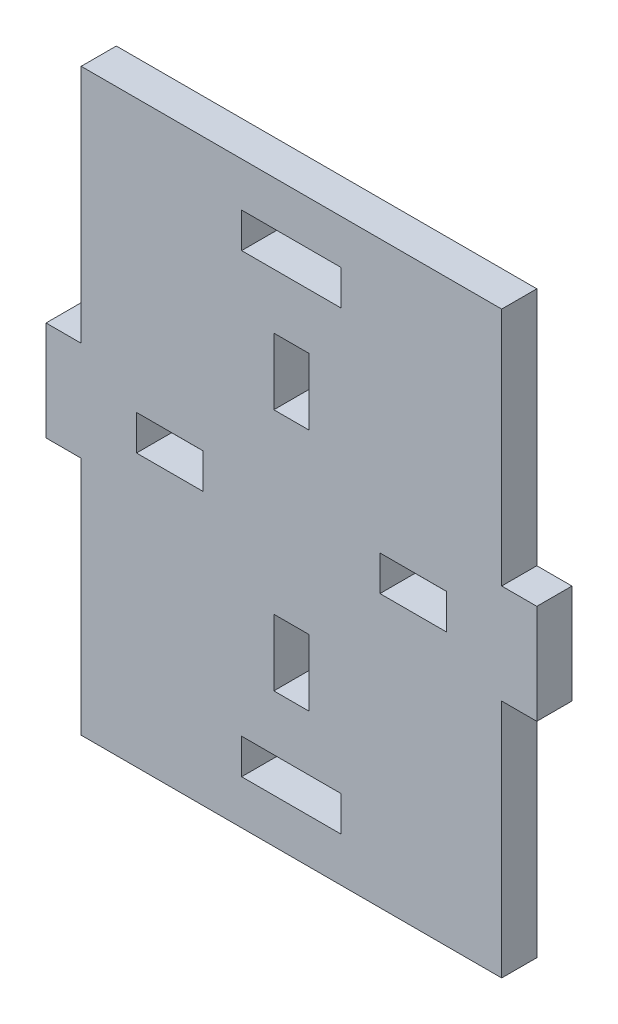
from build123d import *

# Parameters (mm, degrees)
BOSS_EXTRUDE1_DEPTH = 1.5875


with BuildPart() as part:
    # Sketch1 → Boss-Extrude1 (new, symmetric)
    with BuildSketch(Plane.XY):
        Polygon((0, 0), (0, 21.675), (3.175, 21.675), (3.175, 30.675), (0, 30.675), (0, 52.35), (-38, 52.35), (-38, 30.675), (-41.175, 30.675), (-41.175, 21.675), (-38, 21.675), (-38, 0), align=None)
        Polygon((-19, 4), (-14.5, 4), (-14.5, 7.175), (-23.5, 7.175), (-23.5, 4), align=None, mode=Mode.SUBTRACT)
        Polygon((-19, 12.175), (-17.41, 12.175), (-17.41, 18.175), (-20.59, 18.175), (-20.59, 12.175), align=None, mode=Mode.SUBTRACT)
        Polygon((-20.59, 40.175), (-19, 40.175), (-17.41, 40.175), (-17.41, 34.175), (-20.59, 34.175), align=None, mode=Mode.SUBTRACT)
        Polygon((-23.5, 48.35), (-19, 48.35), (-14.5, 48.35), (-14.5, 45.175), (-23.5, 45.175), align=None, mode=Mode.SUBTRACT)
        Polygon((-27, 26.175), (-27, 27.765), (-33, 27.765), (-33, 24.585), (-27, 24.585), align=None, mode=Mode.SUBTRACT)
        Polygon((-11, 24.585), (-11, 26.175), (-11, 27.765), (-5, 27.765), (-5, 24.585), align=None, mode=Mode.SUBTRACT)
    extrude(amount=BOSS_EXTRUDE1_DEPTH, both=True)


solid = part.part
